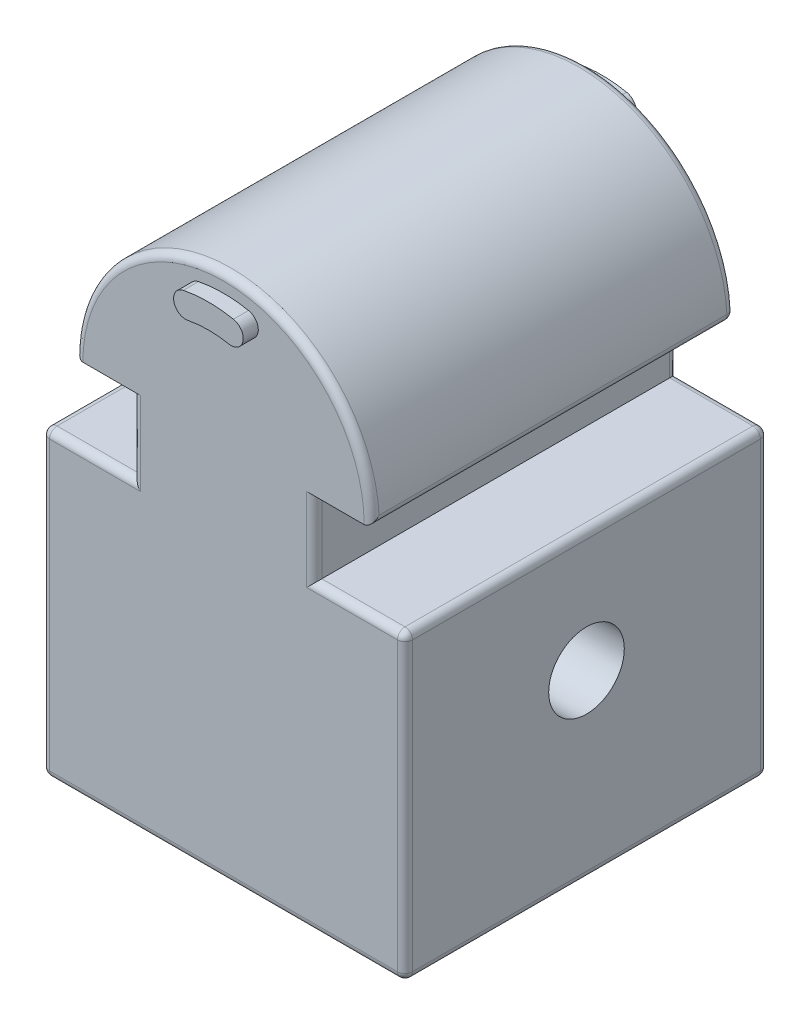
from build123d import *

# Parameters (mm, degrees)
MAIN_BODY_EXTRUDE_DEPTH   = 15.24
SLOT_EXTRUDE_DEPTH        = 16.51
SKETCH2_W                 = 19.05
SKETCH2_H                 = 19.05
FOOT_CONNECTION_CUT_DEPTH = 22.86
PINHOLE_CUT_DEPTH         = 25.4
FILLET1_R                 = 0.635


with BuildPart() as part:
    # Sketch1 → Main Body Extrude (new, symmetric)
    with BuildSketch(Plane.XY):
        with BuildLine():
            ThreePointArc((12.446, 0), (0, 12.446), (-12.446, 0))
            Line((-12.446, 0), (-7.62, 0))
            Line((-7.62, 0), (-7.62, -6.35))
            Line((-7.62, -6.35), (-15.24, -6.35))
            Line((-15.24, -6.35), (-15.24, -31.75))
            Line((-15.24, -31.75), (15.24, -31.75))
            Line((15.24, -31.75), (15.24, -6.35))
            Line((15.24, -6.35), (7.62, -6.35))
            Line((7.62, -6.35), (7.62, 0))
            Line((7.62, 0), (12.446, 0))
        make_face()
        with BuildLine():
            ThreePointArc((2.100384615, 10.71813736), (2.902036033, 9.525716711), (1.709615385, 8.724065293))
            ThreePointArc((1.709615385, 8.724065293), (0, 8.89), (-1.709615385, 8.724065293))
            ThreePointArc((-1.709615385, 8.724065293), (-2.902036033, 9.525716711), (-2.100384615, 10.71813736))
            ThreePointArc((-2.100384615, 10.71813736), (0, 10.922), (2.100384615, 10.71813736))
        make_face(mode=Mode.SUBTRACT)
    extrude(amount=MAIN_BODY_EXTRUDE_DEPTH, both=True)

    # Sketch1<4> → Slot Extrude (add, symmetric)
    with BuildSketch(Plane.XY):
        with BuildLine():
            ThreePointArc((-2.100384615, 10.71813736), (-2.902036033, 9.525716711), (-1.709615385, 8.724065293))
            ThreePointArc((-1.709615385, 8.724065293), (0, 8.89), (1.709615385, 8.724065293))
            ThreePointArc((1.709615385, 8.724065293), (2.902036033, 9.525716711), (2.100384615, 10.71813736))
            ThreePointArc((2.100384615, 10.71813736), (0, 10.922), (-2.100384615, 10.71813736))
        make_face()
    extrude(amount=SLOT_EXTRUDE_DEPTH, both=True)

    # Sketch2 → Foot Connection Cut (cut)
    with BuildSketch(Plane.XZ.offset(31.75)):
        Rectangle(SKETCH2_W, SKETCH2_H)
    extrude(amount=-FOOT_CONNECTION_CUT_DEPTH, mode=Mode.SUBTRACT)

    # Sketch4 → Pinhole Cut (cut, symmetric)
    with BuildSketch(Plane(origin=(-9.525, 0, 0), x_dir=(0, 0, -1), z_dir=(1, 0, 0))):
        with BuildLine():
            ThreePointArc((3.175, -16.51), (2.24506403, -14.26493597), (0, -13.335))
            ThreePointArc((0, -13.335), (-2.24506403, -18.75506403), (3.175, -16.51))
        make_face()
    extrude(amount=PINHOLE_CUT_DEPTH, both=True, mode=Mode.SUBTRACT)

    # Fillet1
    fillet1_edges = [part.edges().sort_by_distance(p)[0] for p in [
        (11.43, -6.35, 15.24),
        (12.446, 0, 0),
        (15.24, -6.35, 0),
        (7.62, -3.175, 15.24),
        (-11.43, -6.35, 15.24),
        (-15.24, -6.35, 0),
        (-7.62, -3.175, 15.24),
        (-12.446, 0, 0),
        (0, 12.446, 15.24),
        (11.43, -6.35, -15.24),
        (7.62, -3.175, -15.24),
        (10.033, 0, -15.24),
        (-10.033, 0, -15.24),
        (-7.62, -3.175, -15.24),
        (-11.43, -6.35, -15.24),
        (0, 12.446, -15.24),
        (15.24, -31.75, 0),
        (-15.24, -31.75, 0),
        (0, -31.75, 15.24),
        (0, -31.75, -15.24),
        (-15.24, -19.05, -15.24),
        (-15.24, -19.05, 15.24),
        (15.24, -19.05, 15.24),
        (15.24, -19.05, -15.24),
    ]]
    fillet(fillet1_edges, radius=FILLET1_R)


solid = part.part
